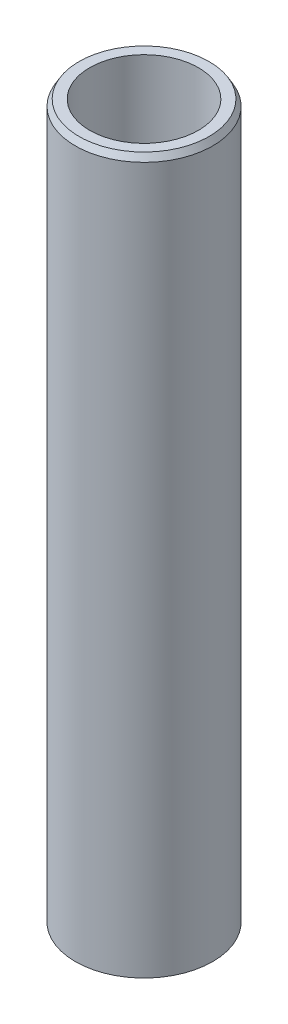
from build123d import *
from OCP.BRepFilletAPI import BRepFilletAPI_MakeChamfer

# Parameters (mm, degrees)
SKETCH1_R           = 57.5
BOSS_EXTRUDE1_DEPTH = 600
SKETCH2_R           = 45.517570656
CUT_EXTRUDE1_DEPTH  = 606.485342515
CHAMFER1_SIZE       = 5.313592443
CHAMFER1_SIZE2      = 3.067804027


with BuildPart() as part:
    # Sketch1 → Boss-Extrude1 (new body)
    with BuildSketch(Plane(origin=(0, 0, 0), x_dir=(1, 0, 0), z_dir=(0, 1, 0))):
        Circle(SKETCH1_R)
    extrude(amount=BOSS_EXTRUDE1_DEPTH)

    # Sketch2 → Cut-Extrude1 (cut, through all)
    with BuildSketch(Plane(origin=(0, 0, 0), x_dir=(1, 0, 0), z_dir=(0, 1, 0))):
        Circle(SKETCH2_R)
    extrude(amount=CUT_EXTRUDE1_DEPTH, mode=Mode.SUBTRACT)

    # Chamfer1: one chamfer whose edges measure the first distance from different faces: ONE call of the kernel's chamfer builder (chamfer() names one face for all edges)
    chamfer1_edges_1 = [part.edges().sort_by_distance(p)[0] for p in [
        (-57.5, 600, 0),
    ]]
    chamfer1_side_1 = [part.faces().sort_by_distance(p)[0] for p in [
        (-57.5, 300, 0),
    ]]
    chamfer1_edges_2 = [part.edges().sort_by_distance(p)[0] for p in [
        (-57.5, 0, 0),
    ]]
    chamfer1_side_2 = [part.faces().sort_by_distance(p)[0] for p in [
        (-55.873654403, 0, 0),
    ]]
    chamfer1 = BRepFilletAPI_MakeChamfer(part.part.solid().wrapped)
    for e in chamfer1_edges_1:
        chamfer1.Add(CHAMFER1_SIZE, CHAMFER1_SIZE2, e.wrapped, chamfer1_side_1[0].wrapped)  # the first distance lies on this face
    for e in chamfer1_edges_2:
        chamfer1.Add(CHAMFER1_SIZE, CHAMFER1_SIZE2, e.wrapped, chamfer1_side_2[0].wrapped)  # the first distance lies on this face
    add(Compound.cast(chamfer1.Shape()), mode=Mode.REPLACE)


solid = part.part
